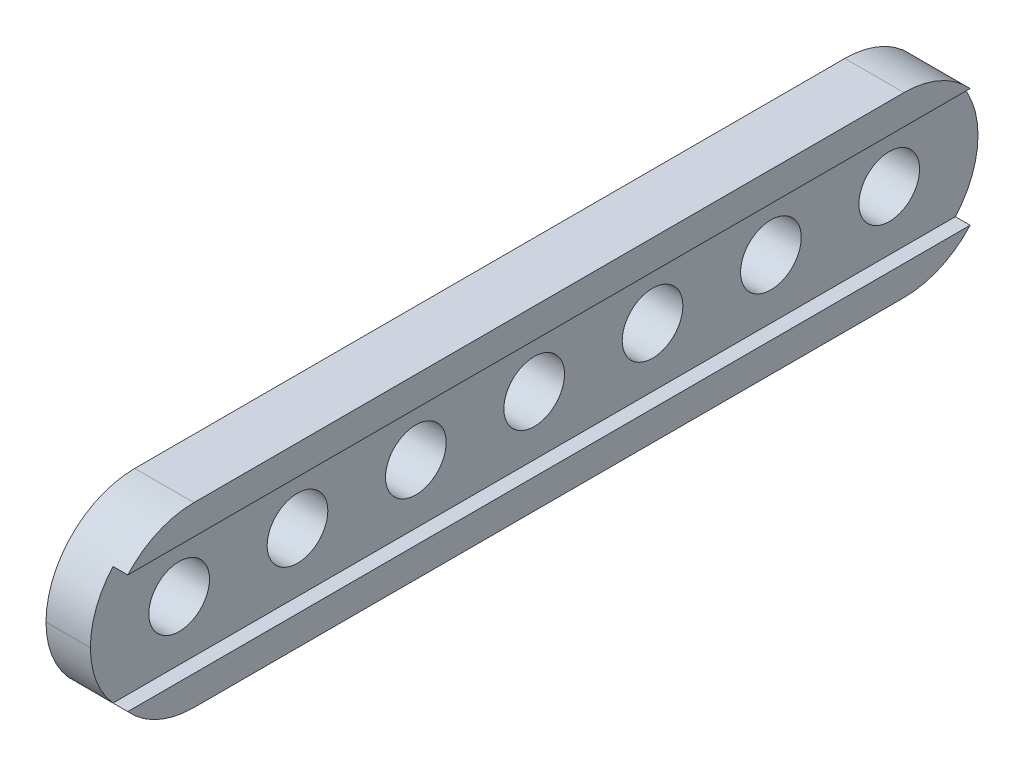
from build123d import *

# Parameters (mm, degrees)
BOSS_EXTRUDE1_DEPTH     = 60
FILLET1_R               = 6
SKETCH2_R               = 2.05
CUT_EXTRUDE1_DEPTH      = 62.318838867
LPATTERN1_COUNT         = 4
LPATTERN1_PITCH         = 8
MIRROR1_COPY_1_SKETCH_R = 2.05
MIRROR1_COPY_1_DEPTH    = 62.318838867
MIRROR1_COPY_2_SKETCH_R = 2.05
MIRROR1_COPY_2_DEPTH    = 62.318838867
MIRROR1_COPY_3_SKETCH_R = 2.05
MIRROR1_COPY_3_DEPTH    = 62.318838867


with BuildPart() as part:
    # Sketch1 → Boss-Extrude1 (new body)
    with BuildSketch(Plane.XY):
        Polygon((0, 0), (4, 0), (4, 2), (3, 2), (3, 10), (4, 10), (4, 12), (0, 12), align=None)
    extrude(amount=-BOSS_EXTRUDE1_DEPTH)

    # Fillet1
    fillet1_edges = [part.edges().sort_by_distance(p)[0] for p in [
        (2, 12, 0),
        (2, 0, 0),
        (2, 0, -60),
        (2, 12, -60),
    ]]
    fillet(fillet1_edges, radius=FILLET1_R - 0.0001)  # a hair under: the kernel refuses the full size

    # Sketch2 → Cut-Extrude1 (cut, through all)
    with BuildSketch(Plane.ZY):
        with Locations(Location((-54, 6, 0), (0, 0, 270))):
            Circle(SKETCH2_R)
    cut_extrude1 = extrude(amount=-CUT_EXTRUDE1_DEPTH, mode=Mode.SUBTRACT)

    # LPattern1: Cut-Extrude1 ×4
    with Locations(*[(0, 0, i * LPATTERN1_PITCH) for i in range(1, LPATTERN1_COUNT)]):
        add(cut_extrude1, mode=Mode.SUBTRACT)

    # Mirror1: Cut-Extrude1 across plane
    add(cut_extrude1.mirror(Plane.XY.offset(-30)), mode=Mode.SUBTRACT)

    # Mirror1 copy 1 sketch → Mirror1 copy 1 (cut, through all)
    with BuildSketch(Plane(origin=(0, 0, -68), x_dir=(0, 0, -1), z_dir=(-1, 0, 0))):
        with Locations((-54, -6)):
            Circle(MIRROR1_COPY_1_SKETCH_R)
    extrude(amount=-MIRROR1_COPY_1_DEPTH, mode=Mode.SUBTRACT)

    # Mirror1 copy 2 sketch → Mirror1 copy 2 (cut, through all)
    with BuildSketch(Plane(origin=(0, 0, -76), x_dir=(0, 0, -1), z_dir=(-1, 0, 0))):
        with Locations((-54, -6)):
            Circle(MIRROR1_COPY_2_SKETCH_R)
    extrude(amount=-MIRROR1_COPY_2_DEPTH, mode=Mode.SUBTRACT)

    # Mirror1 copy 3 sketch → Mirror1 copy 3 (cut, through all)
    with BuildSketch(Plane(origin=(0, 0, -84), x_dir=(0, 0, -1), z_dir=(-1, 0, 0))):
        with Locations((-54, -6)):
            Circle(MIRROR1_COPY_3_SKETCH_R)
    extrude(amount=-MIRROR1_COPY_3_DEPTH, mode=Mode.SUBTRACT)


solid = part.part
